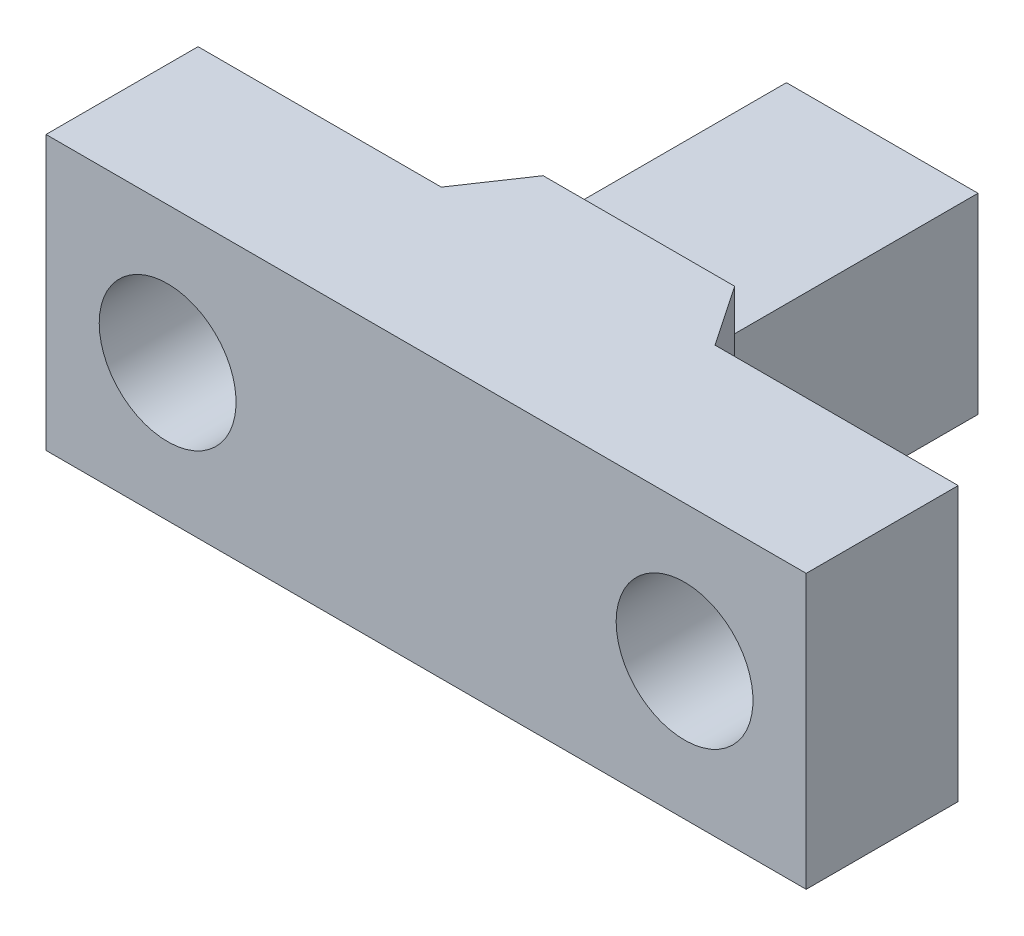
from build123d import *
from OCP.BRepFilletAPI import BRepFilletAPI_MakeChamfer

# Parameters (mm, degrees)
RESSALTO_EXTRUS_O1_DEPTH = 9
ESBO_O2_W                = 9
ESBO_O2_H                = 9
ESBO_O2_W_2              = 6.3
ESBO_O2_H_2              = 6.3
CORTE_EXTRUS_O1_DEPTH    = 8
ESBO_O3_R                = 2.25
CORTE_EXTRUS_O2_DEPTH    = 29.390139133
CHANFRO2_SIZE            = 2
CHANFRO2_SIZE_2          = 1.35


with BuildPart() as part:
    # Esboço1 → Ressalto-extrusão1 (new body)
    with BuildSketch(Plane(origin=(0, 0, 0), x_dir=(1, 0, 0), z_dir=(0, 1, 0))):
        Polygon((0, 0), (25, 0), (25, 5), (17, 5), (17, 15), (8, 15), (8, 5), (0, 5), align=None)
    extrude(amount=RESSALTO_EXTRUS_O1_DEPTH)

    # Esboço2 → Corte-extrusão1 (cut)
    with BuildSketch(Plane(origin=(0, 0, -15), x_dir=(-1, 0, 0), z_dir=(0, 0, -1))):
        with Locations((-12.5, 4.5)):
            Rectangle(ESBO_O2_W, ESBO_O2_H)
        with Locations((-12.5, 4.5)):
            Rectangle(ESBO_O2_W_2, ESBO_O2_H_2, mode=Mode.SUBTRACT)
    extrude(amount=-CORTE_EXTRUS_O1_DEPTH, mode=Mode.SUBTRACT)

    # Esboço3 → Corte-extrusão2 (cut, through all)
    with BuildSketch(Plane(origin=(0, 0, -5), x_dir=(-1, 0, 0), z_dir=(0, 0, -1))):
        with Locations((-4, 4.5)):
            Circle(ESBO_O3_R)
        with Locations((-21, 4.5)):
            Circle(ESBO_O3_R)
    extrude(amount=-CORTE_EXTRUS_O2_DEPTH, mode=Mode.SUBTRACT)

    # Chanfro2
    chanfro2_edges_1 = [part.edges().sort_by_distance(p)[0] for p in [
        (8, 4.5, -7),
    ]]
    chanfro2_side_1 = [part.faces().sort_by_distance(p)[0] for p in [
        (8, 4.5, -6.973),
    ]]
    chanfro2_edges_2 = [part.edges().sort_by_distance(p)[0] for p in [
        (17, 4.5, -7),
    ]]
    chanfro2_side_2 = [part.faces().sort_by_distance(p)[0] for p in [
        (16.973, 4.5, -7),
    ]]
    chanfro2 = BRepFilletAPI_MakeChamfer(part.part.solid().wrapped)
    for e in chanfro2_edges_1:
        chanfro2.Add(CHANFRO2_SIZE - 0.0001, CHANFRO2_SIZE_2 - 0.0001, e.wrapped, chanfro2_side_1[0].wrapped)
    for e in chanfro2_edges_2:
        chanfro2.Add(CHANFRO2_SIZE_2 - 0.0001, CHANFRO2_SIZE - 0.0001, e.wrapped, chanfro2_side_2[0].wrapped)
    add(Compound.cast(chanfro2.Shape()), mode=Mode.REPLACE)  # a hair under: the kernel refuses the full size


solid = part.part
